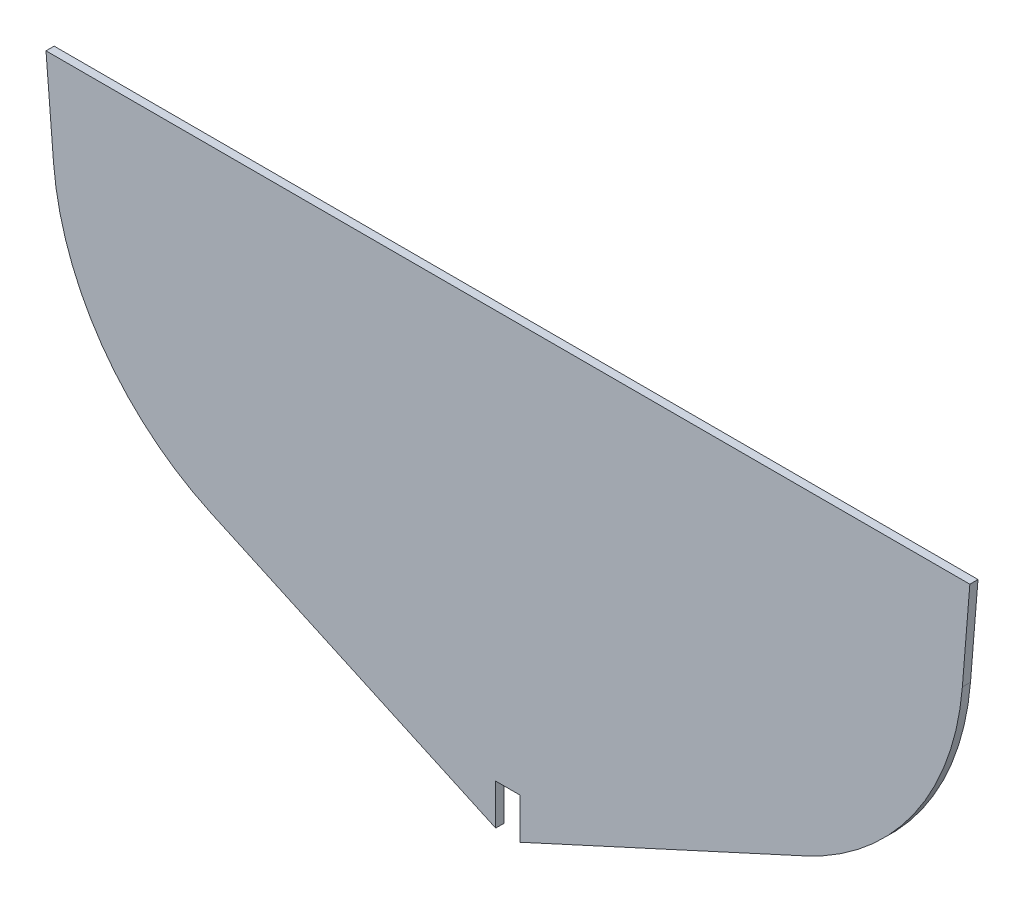
from build123d import *

# Parameters (mm, degrees)
BOSS_EXTRU_1_DEPTH = 3
CONG_1_R           = 100


with BuildPart() as part:
    # Esquisse1 → Boss.-Extru.1 (new body)
    with BuildSketch(Plane.XY):
        Polygon((-133.923413348, 132.631604979), (206.076586652, 132.631604979), (198.592642569, 40.076546408), (40.576586652, -32.368395021), (40.576586652, -17.368395021), (31.576586652, -17.368395021), (31.576586652, -32.368395021), (-126.439469265, 40.076546408), align=None)
    extrude(amount=BOSS_EXTRU_1_DEPTH)

    # Congé1
    cong_1_edges = [part.edges().sort_by_distance(p)[0] for p in [
        (-126.439469265, 40.076546408, 1.5),
        (198.592642569, 40.076546408, 1.5),
    ]]
    fillet(cong_1_edges, radius=CONG_1_R)


solid = part.part
